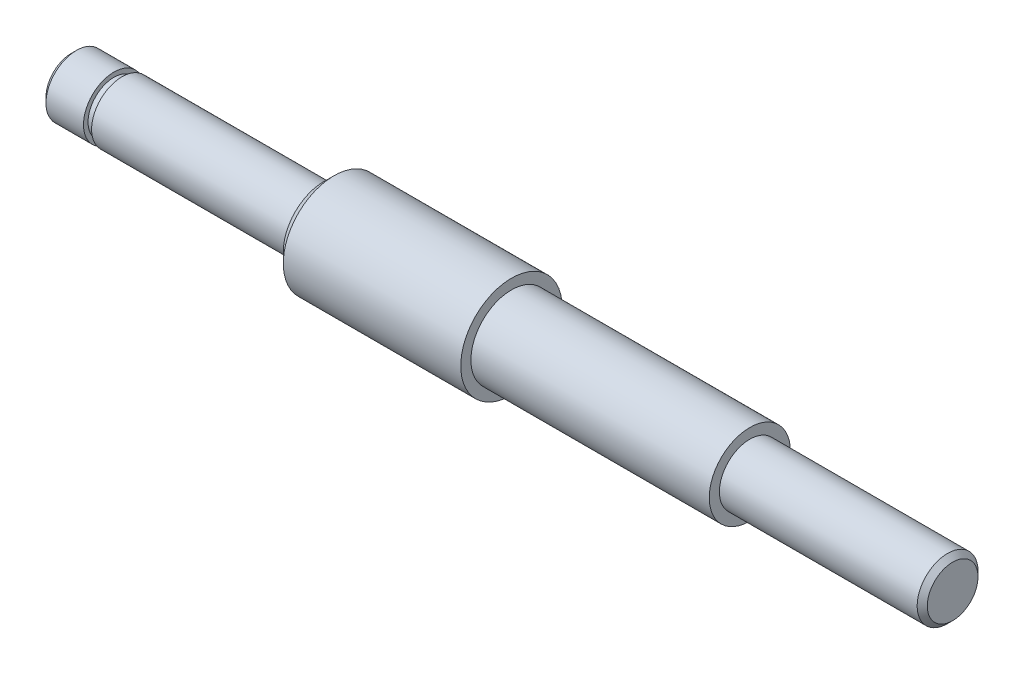
from build123d import *

# Parameters (mm, degrees)
CHAFL_N1_SIZE = 0.5
CHAFL_N2_SIZE = 1


with BuildPart() as part:
    # Croquis1 → Revolución1 (revolve)
    with BuildSketch(Plane(origin=(0, 0, 0), x_dir=(-1, 0, 0), z_dir=(0, 1, 0))):
        Polygon((-43.45, 0), (-43.45, 3), (-23.45, 3), (-23.45, 4), (0.05, 4), (0.05, 5), (18.55, 5), (18.55, 3), (38.45, 3), (38.45, 2.55), (39.25, 2.55), (39.25, 3), (43.45, 3), (43.45, 0), align=None)
    revolve(axis=Axis((43.45, 0, 0), (-1, 0, 0)))

    # Chaflán1
    chafl_n1_edges = [part.edges().sort_by_distance(p)[0] for p in [
        (-43.45, 0, -3),
        (43.45, 0, -3),
    ]]
    chamfer(chafl_n1_edges, length=CHAFL_N1_SIZE)

    # Chaflán2
    chafl_n2_edges = [part.edges().sort_by_distance(p)[0] for p in [
        (-18.55, 0, -5),
    ]]
    chamfer(chafl_n2_edges, length=CHAFL_N2_SIZE)


solid = part.part
